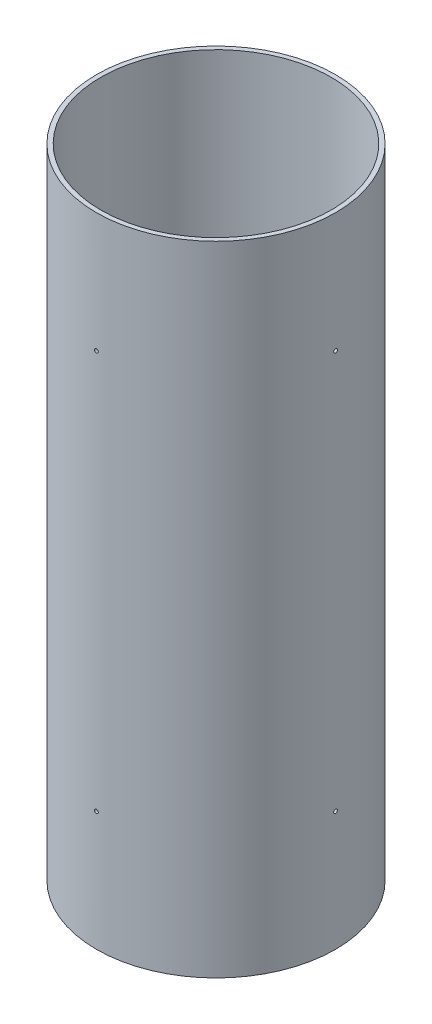
from build123d import *

# Parameters (mm, degrees)
COUPLER_PROFILE_R   = 76.1746
COUPLER_PROFILE_R_2 = 73.3425
COUPLER_BODY_DEPTH  = 406.4
SKETCH1_R           = 1.190625
CUT_EXTRUDE1_DEPTH  = 421.435606687
CIRPATTERN1_COUNT   = 4


with BuildPart() as part:
    # Coupler Profile → Coupler Body (new body)
    with BuildSketch(Plane(origin=(0, 0, 0), x_dir=(1, 0, 0), z_dir=(0, 1, 0))):
        Circle(COUPLER_PROFILE_R)
        Circle(COUPLER_PROFILE_R_2, mode=Mode.SUBTRACT)
    extrude(amount=COUPLER_BODY_DEPTH)

    # Sketch1 → Cut-Extrude1 (cut, symmetric)
    with BuildSketch(Plane.XY):
        with Locations((0, 76.2)):
            Circle(SKETCH1_R)
        with Locations((0, 330.2)):
            Circle(SKETCH1_R)
    cut_extrude1 = extrude(amount=CUT_EXTRUDE1_DEPTH, both=True, mode=Mode.SUBTRACT)

    # CirPattern1: Cut-Extrude1 ×4 about axis
    cirpattern1_axis = Axis((0, 0, 0), (0, 1, 0))
    for i in range(1, CIRPATTERN1_COUNT):
        add(cut_extrude1.rotate(cirpattern1_axis, i * 360 / CIRPATTERN1_COUNT), mode=Mode.SUBTRACT)


solid = part.part
